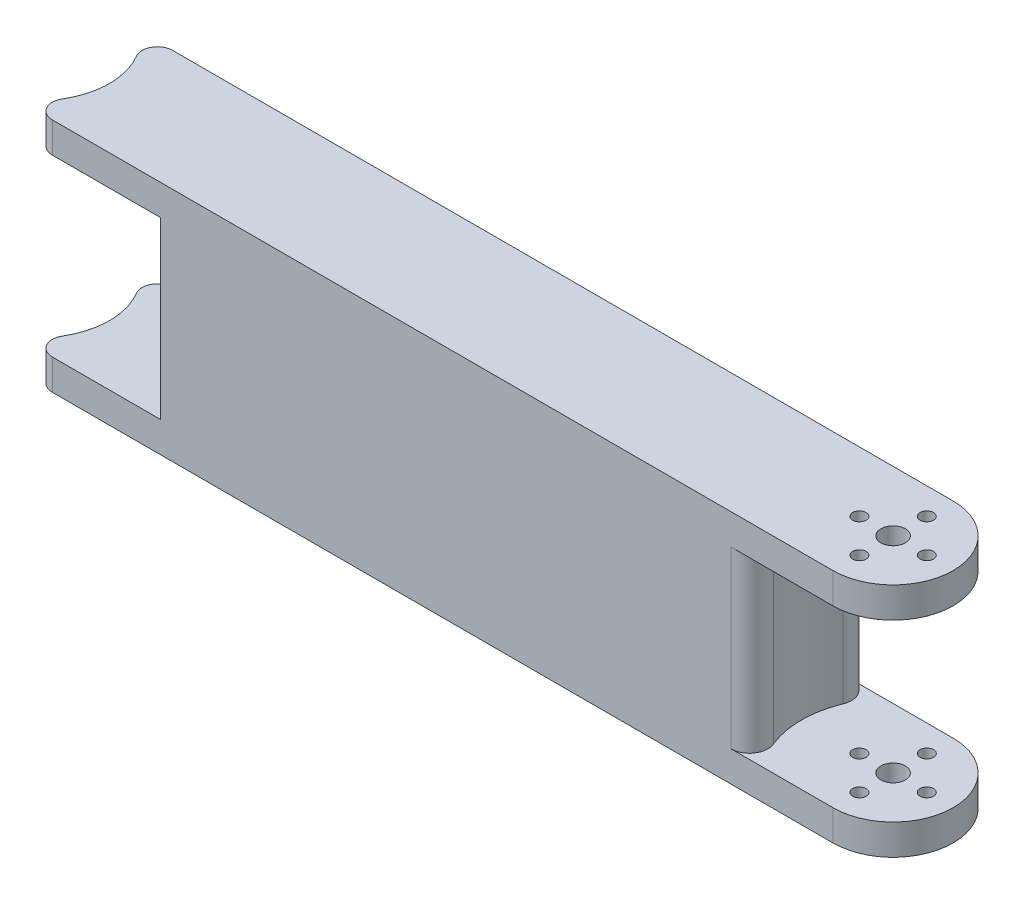
from build123d import *

# Parameters (mm, degrees)
SKETCH1_R           = 1.397
SKETCH1_R_2         = 2.54
BOSS_EXTRUDE1_DEPTH = 6.35
BOSS_EXTRUDE2_DEPTH = 18.161
SKETCH3_R           = 1.397
SKETCH3_R_2         = 2.54
BOSS_EXTRUDE3_DEPTH = 6.35
CUT_EXTRUDE1_START  = -6.35
CUT_EXTRUDE1_DEPTH  = 6.35


with BuildPart() as part:
    # Sketch1 → Boss-Extrude1 (new body)
    with BuildSketch(Plane(origin=(0, 0, 0), x_dir=(1, 0, 0), z_dir=(0, 1, 0))):
        with BuildLine():
            Line((0, 12.5), (177.8, 12.5))
            ThreePointArc((177.8, 12.5), (190.3, 0), (177.8, -12.5))
            Line((177.8, -12.5), (0, -12.5))
            ThreePointArc((0, -12.5), (-12.5, 0), (0, 12.5))
        make_face()
        with Locations((177.8, 7)):
            Circle(SKETCH1_R, mode=Mode.SUBTRACT)
        with Locations((184.8, 0)):
            Circle(SKETCH1_R, mode=Mode.SUBTRACT)
        with Locations((177.8, -7)):
            Circle(SKETCH1_R, mode=Mode.SUBTRACT)
        with Locations((177.8, 0)):
            Circle(SKETCH1_R_2, mode=Mode.SUBTRACT)
        with Locations((170.8, 0)):
            Circle(SKETCH1_R, mode=Mode.SUBTRACT)
    extrude(amount=BOSS_EXTRUDE1_DEPTH)

    # Sketch2 → Boss-Extrude2 (add)
    with BuildSketch(Plane(origin=(0, 6.35, 0), x_dir=(1, 0, 0), z_dir=(0, 1, 0))):
        with BuildLine():
            Line((38.1, 12.5), (156.648877098, 12.5))
            ThreePointArc((156.648877098, 12.5), (159.817559711, 10.809427746), (160.177808671, 7.236081312))
            ThreePointArc((160.177808671, 7.236081312), (158.75, 0), (160.177808671, -7.236081312))
            ThreePointArc((160.177808671, -7.236081312), (159.817559711, -10.809427746), (156.648877098, -12.5))
            Line((156.648877098, -12.5), (38.1, -12.5))
            Line((38.1, -12.5), (38.1, 12.5))
        make_face()
    boss_extrude2 = extrude(amount=BOSS_EXTRUDE2_DEPTH)

    # Mirror1: Boss-Extrude2 across plane
    add(boss_extrude2.mirror(Plane(origin=(156.648877098, 24.511, 8.685142631), x_dir=(0, 0, 1), z_dir=(0, -1, 0))))

    # Sketch3 → Boss-Extrude3 (add)
    with BuildSketch(Plane(origin=(0, 42.672, 0), x_dir=(1, 0, 0), z_dir=(0, 1, 0))):
        with BuildLine():
            Line((15.600480762, 12.5), (177.8, 12.5))
            ThreePointArc((177.8, 12.5), (190.3, 0), (177.8, -12.5))
            Line((177.8, -12.5), (15.600480762, -12.5))
            ThreePointArc((15.600480762, -12.5), (12.838899235, -10.891618163), (12.875224838, -7.696011004))
            ThreePointArc((12.875224838, -7.696011004), (15, 0), (12.875224838, 7.696011004))
            ThreePointArc((12.875224838, 7.696011004), (12.838899235, 10.891618163), (15.600480762, 12.5))
        make_face()
        with Locations((170.8, 0)):
            Circle(SKETCH3_R, mode=Mode.SUBTRACT)
        with Locations((177.8, 0)):
            Circle(SKETCH3_R_2, mode=Mode.SUBTRACT)
        with Locations((177.8, -7)):
            Circle(SKETCH3_R, mode=Mode.SUBTRACT)
        with Locations((184.8, 0)):
            Circle(SKETCH3_R, mode=Mode.SUBTRACT)
        with Locations((177.8, 7)):
            Circle(SKETCH3_R, mode=Mode.SUBTRACT)
    extrude(amount=BOSS_EXTRUDE3_DEPTH)

    # Sketch4 → Cut-Extrude1 (cut)
    with BuildSketch(Plane(origin=(0, 6.35, 0), x_dir=(1, 0, 0), z_dir=(0, 1, 0)).offset(CUT_EXTRUDE1_START)):
        with BuildLine():
            Line((15.600480762, 12.5), (0, 12.5))
            ThreePointArc((0, 12.5), (-12.5, 0), (0, -12.5))
            Line((0, -12.5), (15.600480762, -12.5))
            ThreePointArc((15.600480762, -12.5), (12.838899235, -10.891618163), (12.875224838, -7.696011004))
            ThreePointArc((12.875224838, -7.696011004), (15, 0), (12.875224838, 7.696011004))
            ThreePointArc((12.875224838, 7.696011004), (12.838899235, 10.891618163), (15.600480762, 12.5))
        make_face()
    extrude(amount=CUT_EXTRUDE1_DEPTH, mode=Mode.SUBTRACT)


solid = part.part
